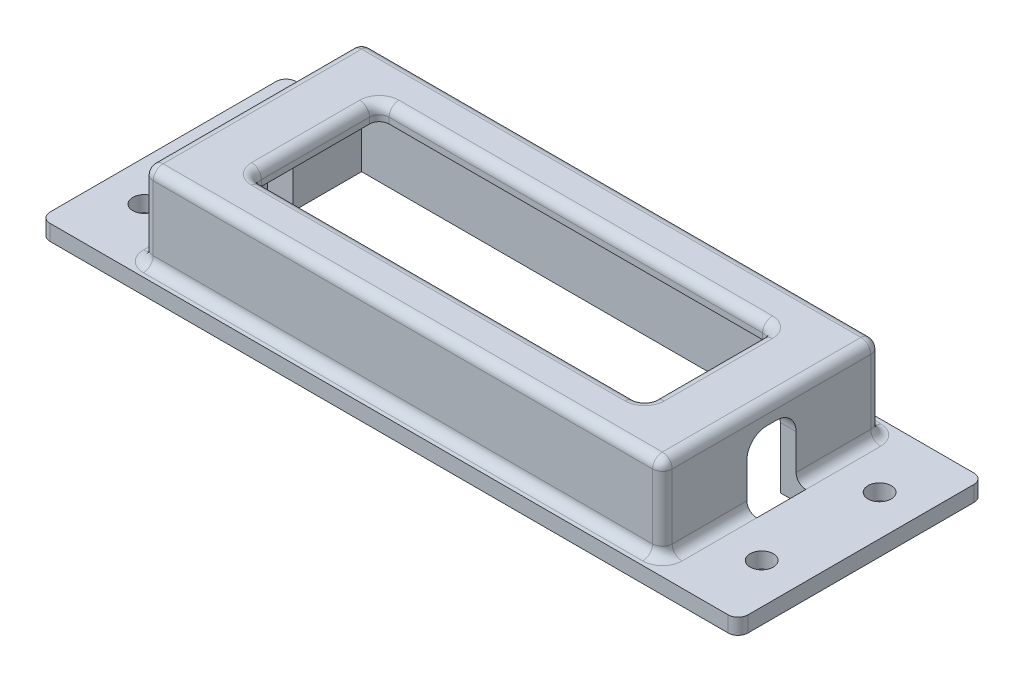
from build123d import *

# Parameters (mm, degrees)
SKETCH1_W           = 62.992
SKETCH1_H           = 24.13
BOSS_EXTRUDE1_DEPTH = 8.89
SHELL1_T            = 2.032
SKETCH2_W           = 6.35
SKETCH2_H           = 5.842
CUT_EXTRUDE1_DEPTH  = 8.89
SKETCH3_W           = 6.35
SKETCH3_H           = 8.382
CUT_EXTRUDE2_DEPTH  = 8.89
FILLET1_R           = 2.54
SKETCH4_W           = 90.17
SKETCH4_H           = 31.75
SKETCH4_R           = 1.5
BOSS_EXTRUDE2_DEPTH = 2.032
SKETCH5_W           = 62.992
SKETCH5_H           = 24.13
CUT_EXTRUDE3_DEPTH  = 10.922
FILLET2_R           = 1.27
SKETCH6_W           = 50.8
SKETCH6_H           = 16.51
CUT_EXTRUDE4_DEPTH  = 10.922
FILLET3_R           = 1.27
SKETCH8_W           = 3.302
SKETCH8_H           = 6.35
CUT_EXTRUDE5_DEPTH  = 10.922


with BuildPart() as part:
    # Sketch1 → Boss-Extrude1 (new body)
    with BuildSketch(Plane(origin=(0, 0, 0), x_dir=(1, 0, 0), z_dir=(0, 1, 0))):
        Rectangle(SKETCH1_W, SKETCH1_H)
    extrude(amount=BOSS_EXTRUDE1_DEPTH)

    # Shell1
    shell1_openings = [part.faces().sort_by_distance(p)[0] for p in [
        (0, 0, 0),
    ]]
    offset(amount=SHELL1_T, openings=shell1_openings, kind=Kind.INTERSECTION)

    # Sketch2 → Cut-Extrude1 (cut)
    with BuildSketch(Plane.ZY.offset(33.528)):
        with Locations((0, 2.921)):
            Rectangle(SKETCH2_W, SKETCH2_H)
    extrude(amount=-CUT_EXTRUDE1_DEPTH, mode=Mode.SUBTRACT)

    # Sketch3 → Cut-Extrude2 (cut)
    with BuildSketch(Plane(origin=(33.528, 0, 0), x_dir=(0, 0, -1), z_dir=(1, 0, 0))):
        with Locations((0, 4.191)):
            Rectangle(SKETCH3_W, SKETCH3_H)
    extrude(amount=-CUT_EXTRUDE2_DEPTH, mode=Mode.SUBTRACT)

    # Fillet1
    fillet1_edges = [part.edges().sort_by_distance(p)[0] for p in [
        (-32.512, 5.842, 3.175),
        (-32.512, 5.842, -3.175),
        (32.512, 8.382, -3.175),
        (32.512, 8.382, 3.175),
    ]]
    fillet(fillet1_edges, radius=FILLET1_R)

    # Sketch4 → Boss-Extrude2 (add)
    with BuildSketch(Plane.XZ):
        Rectangle(SKETCH4_W, SKETCH4_H)
        with Locations((-39.878, 7.62)):
            Circle(SKETCH4_R, mode=Mode.SUBTRACT)
        with Locations((-39.878, -7.62)):
            Circle(SKETCH4_R, mode=Mode.SUBTRACT)
        with Locations((39.878, -7.62)):
            Circle(SKETCH4_R, mode=Mode.SUBTRACT)
        with Locations((39.878, 7.62)):
            Circle(SKETCH4_R, mode=Mode.SUBTRACT)
    extrude(amount=BOSS_EXTRUDE2_DEPTH)

    # Sketch5 → Cut-Extrude3 (cut)
    with BuildSketch(Plane.XZ.offset(2.032)):
        Rectangle(SKETCH5_W, SKETCH5_H)
    extrude(amount=-CUT_EXTRUDE3_DEPTH, mode=Mode.SUBTRACT)

    # Fillet2
    fillet2_edges = [part.edges().sort_by_distance(p)[0] for p in [
        (0, 10.922, 14.097),
        (-33.528, 10.922, 0),
        (0, 10.922, -14.097),
        (33.528, 10.922, 0),
        (-45.085, -1.016, 15.875),
        (-45.085, -1.016, -15.875),
        (45.085, -1.016, -15.875),
        (45.085, -1.016, 15.875),
        (-33.528, 5.461, -14.097),
        (-33.528, 5.461, 14.097),
        (33.528, 5.461, 14.097),
        (33.528, 5.461, -14.097),
    ]]
    fillet(fillet2_edges, radius=FILLET2_R)
    fillet2_2_edges = [part.edges().sort_by_distance(p)[0] for p in [
        (0, 0, -14.097),
        (33.528, 0, -8.001),
        (33.528, 0, 8.001),
        (0, 0, 14.097),
        (-33.528, 0, 8.001),
        (-33.528, 0, -8.001),
        (-33.156025612, 0, -13.725025612),
        (-33.156025612, 0, 13.725025612),
        (33.156025612, 0, 13.725025612),
        (33.156025612, 0, -13.725025612),
    ]]
    fillet(fillet2_2_edges, radius=FILLET2_R)

    # Sketch6 → Cut-Extrude4 (cut)
    with BuildSketch(Plane(origin=(0, 10.922, 0), x_dir=(1, 0, 0), z_dir=(0, 1, 0))):
        Rectangle(SKETCH6_W, SKETCH6_H)
    extrude(amount=-CUT_EXTRUDE4_DEPTH, mode=Mode.SUBTRACT)

    # Fillet3
    fillet3_edges = [part.edges().sort_by_distance(p)[0] for p in [
        (-25.4, 10.922, 0),
        (0, 10.922, 8.255),
        (0, 10.922, -8.255),
        (25.4, 10.922, 0),
        (25.4, 9.906, -8.255),
        (25.4, 9.906, 8.255),
        (-25.4, 9.906, -8.255),
        (-25.4, 9.906, 8.255),
    ]]
    fillet(fillet3_edges, radius=FILLET3_R)

    # Sketch8 → Cut-Extrude5 (cut)
    with BuildSketch(Plane(origin=(0, 0, 0), x_dir=(1, 0, 0), z_dir=(0, 1, 0))):
        with Locations((-33.147, 0)):
            Rectangle(SKETCH8_W, SKETCH8_H)
        with Locations((33.147, 0)):
            Rectangle(SKETCH8_W, SKETCH8_H)
    extrude(amount=-CUT_EXTRUDE5_DEPTH, mode=Mode.SUBTRACT)


solid = part.part
